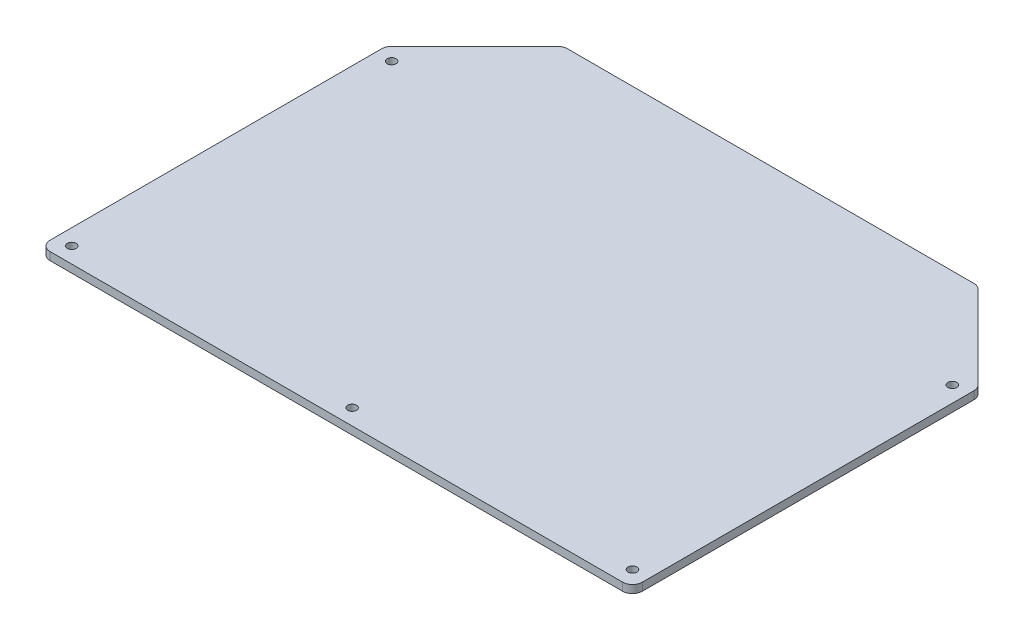
from build123d import *

# Parameters (mm, degrees)
MAIN_EXTRUSION_DEPTH = 4
CORNER_LEAVE_R       = 5
D_GAGEMENT_M41_D     = 4.5


with BuildPart() as part:
    # Main scetch → Main extrusion (new body)
    with BuildSketch(Plane(origin=(0, 0, 0), x_dir=(1, 0, 0), z_dir=(0, 1, 0))):
        Polygon((-150, 0), (150, 0), (150, 175), (105, 220), (-105, 220), (-150, 175), align=None)
    extrude(amount=MAIN_EXTRUSION_DEPTH)

    # Corner leave
    corner_leave_edges = [part.edges().sort_by_distance(p)[0] for p in [
        (-150, 2, 0),
        (150, 2, -175),
        (105, 2, -220),
        (150, 2, 0),
        (-105, 2, -220),
        (-150, 2, -175),
    ]]
    fillet(corner_leave_edges, radius=CORNER_LEAVE_R)

    # Dégagement M41 (through all)
    with Locations(Plane(origin=(0, 4, 0), x_dir=(1, 0, 0), z_dir=(0, 1, 0))):
        with Locations((-142, 8), (-142, 170), (142, 170), (142, 8), (0, 8)):
            Hole(D_GAGEMENT_M41_D / 2)


solid = part.part
